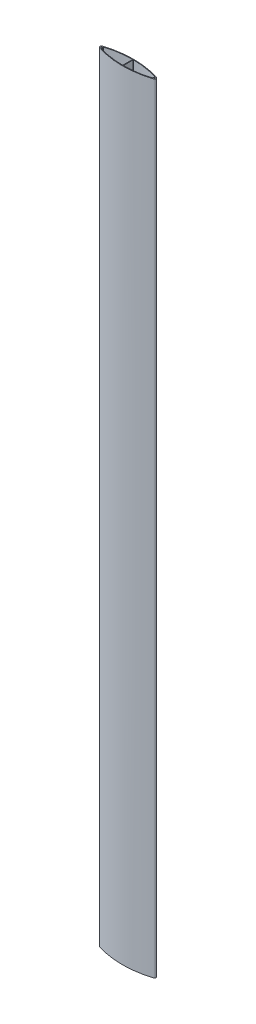
from build123d import *

# Parameters (mm, degrees)
LOFT1_DEPTH        = 2100
CUT_EXTRUDE1_DEPTH = 2354


# Read off the part's stored shape, not the designer's step: Loft1
with BuildPart() as part:
    # Loft1 outline → Loft1 (new body)
    with BuildSketch(Plane(origin=(0, 0, 0), x_dir=(1, 0, 0), z_dir=(0, 1, 0))):
        with BuildLine():
            add(Edge.make_bspline(
                [(161.196391024, -3.807009689), (161.595777085, -3.678238403), (162.353679807, -3.294061312), (163.256214766, -2.393975001), (163.835817652, -1.258843876), (164.035559564, 0), (163.835817652, 1.258843876), (163.256214766, 2.393975001), (162.353679807, 3.294061312), (161.595777085, 3.678238403), (149.470776039, 7.587618654), (125.428963369, 13.3168584), (88.468923212, 16.20434058), (63.828896441, 14.27935246), (51.65843658, 12.365795493), (39.48797672, 10.452238527), (27.467070385, 7.587618654), (15.34206934, 3.678238403), (14.584162251, 3.294042038), (13.681666916, 2.394011216), (13.102006394, 1.258869379), (12.968923212, 0.419632303), (12.968923212, 0), (12.968923212, -0.419632303), (13.102006394, -1.258869379), (13.681666916, -2.394011216), (14.584162251, -3.294042038), (15.34206934, -3.678238403), (27.467070385, -7.587618654), (51.508883055, -13.3168584), (88.468923212, -16.20434058), (125.428963369, -13.3168584), (149.470776039, -7.587618654), (161.196391024, -3.807009689)],
                knots=[1.484055664, 1.484055664, 1.484055664, 1.484055664, 1.488041748, 1.492027832, 1.496013916, 1.5, 1.503986084, 1.507972168, 1.511958252, 1.515944336, 1.515944336, 1.632972168, 1.75, 1.867027832, 1.867027832, 1.867027832, 1.984055664, 1.984055664, 1.988041748, 1.992027832, 1.996013916, 2, 2, 2, 2.003986084, 2.007972168, 2.011958252, 2.015944336, 2.015944336, 2.132972168, 2.25, 2.367027832, 2.484055664, 2.484055664, 2.484055664, 2.484055664], degree=3))
        make_face()
    extrude(amount=LOFT1_DEPTH)

    # Sketch7<3> → Cut-Extrude1 (cut)
    with BuildSketch(Plane(origin=(0, 2100, 0), x_dir=(1, 0, 0), z_dir=(0, 1, 0))):
        with BuildLine():
            Line((89.318923212, -13.037804618), (89.318923212, 13.037804618))
            ThreePointArc((89.318923212, 13.037804618), (89.466387677, 13.392372942), (89.821797999, 13.537796353))
            ThreePointArc((89.821797999, 13.537796353), (123.964044205, 10.849050899), (157.354331586, 3.232553234))
            ThreePointArc((157.354331586, 3.232553234), (157.693054479, 2.87560944), (157.561924197, 2.401323747))
            ThreePointArc((157.561924197, 2.401323747), (157.459387138, 2.293954815), (157.361635117, 2.182211903))
            ThreePointArc((157.361635117, 2.182211903), (157.252710465, 1.774165754), (157.495059837, 1.428285686))
            Line((157.495059837, 1.428285686), (158.41248497, 0.898610038))
            ThreePointArc((158.41248497, 0.898610038), (158.485672716, 0.887938078), (158.546175984, 0.930478546))
            ThreePointArc((158.546175984, 0.930478546), (161.668923212, 0), (158.546175984, -0.930478546))
            ThreePointArc((158.546175984, -0.930478546), (158.485672716, -0.887938078), (158.41248497, -0.898610038))
            Line((158.41248497, -0.898610038), (157.495059837, -1.428285686))
            ThreePointArc((157.495059837, -1.428285686), (157.252710465, -1.774165754), (157.361635117, -2.182211903))
            ThreePointArc((157.361635117, -2.182211903), (157.459387138, -2.293954815), (157.561924197, -2.401323747))
            ThreePointArc((157.561924197, -2.401323747), (157.693054479, -2.875609441), (157.354331586, -3.232553234))
            ThreePointArc((157.354331586, -3.232553234), (123.964044205, -10.849050899), (89.821797999, -13.537796353))
            ThreePointArc((89.821797999, -13.537796353), (89.466387677, -13.392372942), (89.318923212, -13.037804618))
        make_face()
        with BuildLine():
            Line((19.442786587, -1.428285686), (18.525361454, -0.898610038))
            ThreePointArc((18.525361454, -0.898610038), (18.452173708, -0.887938078), (18.39167044, -0.930478546))
            ThreePointArc((18.39167044, -0.930478546), (15.268923212, 0), (18.39167044, 0.930478546))
            ThreePointArc((18.39167044, 0.930478546), (18.452173708, 0.887938078), (18.525361454, 0.898610038))
            Line((18.525361454, 0.898610038), (19.442786587, 1.428285686))
            ThreePointArc((19.442786587, 1.428285686), (19.685135959, 1.774165754), (19.576211307, 2.182211903))
            ThreePointArc((19.576211307, 2.182211903), (19.478459286, 2.293954815), (19.375922227, 2.401323747))
            ThreePointArc((19.375922227, 2.401323747), (19.244791945, 2.87560944), (19.583514837, 3.232553234))
            ThreePointArc((19.583514837, 3.232553234), (52.973802219, 10.849050899), (87.116048425, 13.537796353))
            ThreePointArc((87.116048425, 13.537796353), (87.471458747, 13.392372942), (87.618923212, 13.037804618))
            Line((87.618923212, 13.037804618), (87.618923212, -13.037804618))
            ThreePointArc((87.618923212, -13.037804618), (87.471458747, -13.392372942), (87.116048425, -13.537796353))
            ThreePointArc((87.116048425, -13.537796353), (52.973802219, -10.849050899), (19.583514837, -3.232553234))
            ThreePointArc((19.583514837, -3.232553234), (19.244791945, -2.875609441), (19.375922227, -2.401323747))
            ThreePointArc((19.375922227, -2.401323747), (19.478459286, -2.293954815), (19.576211307, -2.182211903))
            ThreePointArc((19.576211307, -2.182211903), (19.685135959, -1.774165754), (19.442786587, -1.428285686))
        make_face()
    extrude(amount=-CUT_EXTRUDE1_DEPTH, mode=Mode.SUBTRACT)


solid = part.part
